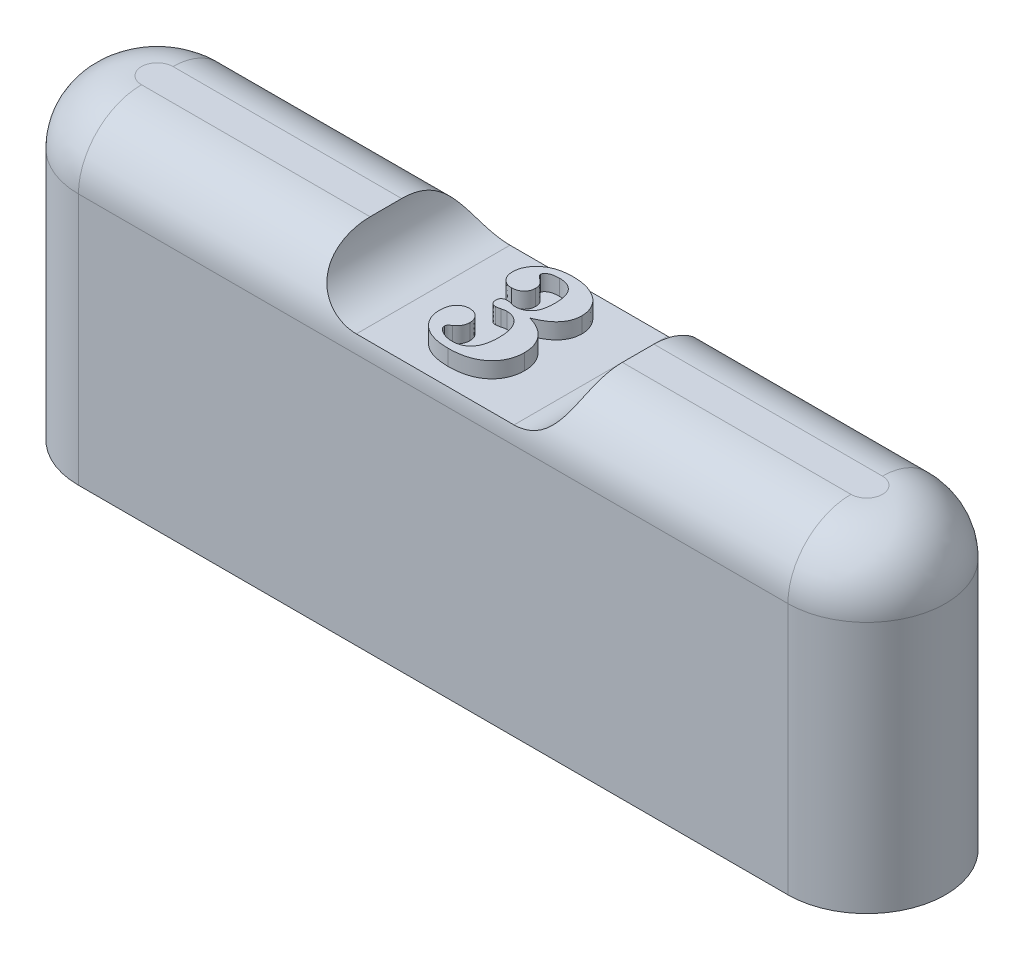
from build123d import *

# Parameters (mm, degrees)
BOSS_EXTRUDE1_DEPTH     = 20
FILLET1_R               = 4
SKETCH2_R               = 2.75
CUT_EXTRUDE1_DEPTH      = 1.5
LPATTERN1_COUNT         = 2
LPATTERN1_PITCH         = 30
CUT_EXTRUDE2_DEPTH      = 35.369317712
CUT_EXTRUDE2_DEPTH_BACK = 35.369317712
WRAP1_DEPTH             = 1


# Read off the part's stored shape, not the designer's step: Wrap1
with BuildPart() as part:
    # Sketch1 → Boss-Extrude1 (new body)
    with BuildSketch(Plane(origin=(0, 0, 0), x_dir=(1, 0, 0), z_dir=(0, 1, 0))):
        with BuildLine():
            Line((22.5, -5), (-22.5, -5))
            ThreePointArc((-22.5, -5), (-27.5, 0), (-22.5, 5))
            Line((-22.5, 5), (22.5, 5))
            ThreePointArc((22.5, 5), (27.5, 0), (22.5, -5))
        make_face()
    extrude(amount=BOSS_EXTRUDE1_DEPTH)

    # Fillet1
    fillet1_edges = [part.edges().sort_by_distance(p)[0] for p in [
        (-27.5, 20, 0),
        (0, 20, 5),
        (27.5, 20, 0),
        (0, 20, -5),
    ]]
    fillet(fillet1_edges, radius=FILLET1_R)

    # Sketch2 → Cut-Extrude1 (cut)
    with BuildSketch(Plane.XZ):
        with Locations(Location((-22.5, 0, 0), (0, 0, 270))):
            Circle(SKETCH2_R)
    cut_extrude1 = extrude(amount=-CUT_EXTRUDE1_DEPTH, mode=Mode.SUBTRACT)

    # LPattern1: Cut-Extrude1 ×2
    with Locations(*[(i * LPATTERN1_PITCH, 0, 0) for i in range(1, LPATTERN1_COUNT)]):
        add(cut_extrude1, mode=Mode.SUBTRACT)

    # Sketch3 → Cut-Extrude2 (cut, two sides: drawn at the far end of the back side and taken through both)
    with BuildSketch(Plane.XY.offset(-CUT_EXTRUDE2_DEPTH_BACK)):
        with BuildLine():
            Line((-5, 23), (5, 23))
            ThreePointArc((5, 23), (8, 20), (5, 17))
            Line((5, 17), (-5, 17))
            ThreePointArc((-5, 17), (-8, 20), (-5, 23))
        make_face()
    extrude(amount=CUT_EXTRUDE2_DEPTH + CUT_EXTRUDE2_DEPTH_BACK, mode=Mode.SUBTRACT)

    # Wrap1 outline → Wrap1 (add)
    with BuildSketch(Plane(origin=(0, 17, 0), x_dir=(1, 0, 0), z_dir=(0, 1, 0))):
        with BuildLine():
            add(Edge.make_bspline(
                [(2.361186809, -1.562724739), (2.358936063, -1.642416183), (2.354521526, -1.798720277), (2.32263398, -2.027872613), (2.266249939, -2.244790925), (2.188119546, -2.450129201), (2.091831204, -2.645528484), (1.966868403, -2.825594366), (1.824652142, -2.996727537), (1.65918003, -3.153264834), (1.474410823, -3.294496531), (1.27162083, -3.418493187), (1.050690637, -3.522780333), (0.812275633, -3.607617071), (0.556367941, -3.673236459), (0.28287175, -3.718531246), (-0.007811165, -3.748432548), (-0.207645189, -3.751734077), (-0.31028755, -3.753429868)],
                knots=[0, 0, 0, 0, 0.061354375, 0.120338389, 0.177702509, 0.233546768, 0.289283374, 0.3449562, 0.401886605, 0.460365064, 0.51992708, 0.580664812, 0.643036542, 0.707697668, 0.775236972, 0.846171603, 0.920987881, 1, 1, 1, 1], degree=3))
            add(Edge.make_bspline(
                [(0.624007322, 0.502980389), (0.694363155, 0.482741857), (0.831874438, 0.443185413), (1.02740048, 0.366120544), (1.210793188, 0.283964567), (1.380029067, 0.190457087), (1.535517537, 0.087559953), (1.679820629, -0.023012478), (1.809194549, -0.144808387), (1.925167532, -0.275441854), (2.027972458, -0.413012739), (2.116353701, -0.558215329), (2.191887622, -0.709393145), (2.255222154, -0.867186368), (2.302888581, -1.032105612), (2.336290336, -1.203752461), (2.358006646, -1.381075408), (2.360119546, -1.501763193), (2.361186809, -1.562724739)],
                knots=[0, 0, 0, 0, 0.075025699, 0.146638589, 0.215271416, 0.280976256, 0.344630791, 0.406315274, 0.467154943, 0.526516949, 0.585236113, 0.643010064, 0.700575913, 0.758349864, 0.817112444, 0.876302356, 0.937518121, 1, 1, 1, 1], degree=3))
            add(Edge.make_bspline(
                [(2.156058604, 2.272211158), (2.151771848, 2.181525798), (2.143309797, 2.002513021), (2.074708117, 1.741373033), (1.962761703, 1.495703312), (1.83395055, 1.304553765), (1.70700455, 1.162189231), (1.597891224, 1.054509002), (1.470220171, 0.955468322), (1.330325856, 0.856344283), (1.174738268, 0.763142335), (1.005278854, 0.670570327), (0.82048556, 0.583282024), (0.690502902, 0.530157464), (0.624007322, 0.502980389)],
                knots=[0, 0, 0, 0, 0.108587554, 0.214351684, 0.321241858, 0.430999345, 0.489069076, 0.549749196, 0.614451706, 0.682490285, 0.755190336, 0.831693801, 0.913899143, 1, 1, 1, 1], degree=3))
            add(Edge.make_bspline(
                [(-0.279838832, 4.14400603), (-0.157357142, 4.140985963), (0.079990149, 4.135133623), (0.422790871, 4.088566309), (0.739891528, 4.010904136), (1.028548789, 3.899630755), (1.289047424, 3.764529224), (1.517589649, 3.604544138), (1.71433849, 3.423204268), (1.873120708, 3.217672668), (1.998783534, 2.997948183), (2.089517596, 2.76593386), (2.146708195, 2.522840543), (2.152917989, 2.356392537), (2.156058604, 2.272211158)],
                knots=[0, 0, 0, 0, 0.10695053, 0.207250721, 0.301516556, 0.391461648, 0.476821793, 0.557207781, 0.634455968, 0.709589712, 0.783146573, 0.854802433, 0.926566069, 1, 1, 1, 1], degree=3))
            add(Edge.make_bspline(
                [(-2.000992678, 3.538236799), (-1.950449089, 3.587285963), (-1.849201756, 3.685539712), (-1.672695867, 3.806855819), (-1.481361956, 3.911138376), (-1.273937972, 3.99840966), (-1.049047665, 4.063820316), (-0.807482815, 4.109244053), (-0.549271825, 4.138986214), (-0.371271112, 4.142302552), (-0.279838832, 4.14400603)],
                knots=[0, 0, 0, 0, 0.112520394, 0.225397328, 0.341295234, 0.46082693, 0.584695833, 0.715280351, 0.853750211, 1, 1, 1, 1], degree=3))
            add(Edge.make_bspline(
                [(-2.459326011, 2.496570132), (-2.458422807, 2.544223667), (-2.456626238, 2.639011565), (-2.432043319, 2.778796807), (-2.39838683, 2.91596632), (-2.345251724, 3.04770288), (-2.281405572, 3.176962423), (-2.201929684, 3.302140116), (-2.10942833, 3.424633497), (-2.037566369, 3.499920139), (-2.000992678, 3.538236799)],
                knots=[0, 0, 0, 0, 0.122161592, 0.242992273, 0.363386459, 0.4840848, 0.606730262, 0.733038715, 0.864131742, 1, 1, 1, 1], degree=3))
            add(Edge.make_bspline(
                [(-1.613172165, 1.579903466), (-1.670691333, 1.582817891), (-1.783577705, 1.588537704), (-1.944660288, 1.638574348), (-2.091701292, 1.71925779), (-2.220564617, 1.831251337), (-2.326080958, 1.969543422), (-2.405265192, 2.127843577), (-2.450176571, 2.306655204), (-2.456200042, 2.431684395), (-2.459326011, 2.496570132)],
                knots=[0, 0, 0, 0, 0.123503177, 0.242385729, 0.359144057, 0.482175805, 0.606759678, 0.731136659, 0.860469416, 1, 1, 1, 1], degree=3))
            add(Edge.make_bspline(
                [(-0.81830037, 2.315480389), (-0.821026256, 2.264447662), (-0.8263186, 2.16536691), (-0.869167775, 2.022915244), (-0.943734194, 1.896045689), (-1.042845988, 1.784541099), (-1.162705506, 1.692435373), (-1.300832872, 1.628353149), (-1.452030242, 1.586024445), (-1.558385148, 1.581984552), (-1.613172165, 1.579903466)],
                knots=[0, 0, 0, 0, 0.126444231, 0.245493237, 0.364814777, 0.488720188, 0.613543272, 0.736823611, 0.86442892, 1, 1, 1, 1], degree=3))
            add(Edge.make_bspline(
                [(-1.24778755, 3.001377825), (-1.207150225, 2.970005913), (-1.131787845, 2.911826346), (-1.035010933, 2.820984441), (-0.958206948, 2.738654777), (-0.902818224, 2.659121006), (-0.864401787, 2.579872645), (-0.836830656, 2.497613288), (-0.82052087, 2.408540067), (-0.819054037, 2.347066044), (-0.81830037, 2.315480389)],
                knots=[0, 0, 0, 0, 0.182070801, 0.337652372, 0.470523462, 0.580943793, 0.680135151, 0.782042625, 0.888012428, 1, 1, 1, 1], degree=3))
            add(Edge.make_bspline(
                [(-1.433684986, 3.249775261), (-1.432930177, 3.229260144), (-1.431547568, 3.191681915), (-1.411917574, 3.146236861), (-1.38299006, 3.115082097), (-1.349546998, 3.083846064), (-1.303891536, 3.04437996), (-1.267721727, 3.016656814), (-1.24778755, 3.001377825)],
                knots=[0, 0, 0, 0, 0.188481556, 0.345248003, 0.443161045, 0.579238055, 0.768106505, 1, 1, 1, 1], degree=3))
            add(Edge.make_bspline(
                [(-0.611569601, 3.631185517), (-0.67466762, 3.629680056), (-0.793299335, 3.626849613), (-0.959707154, 3.605420198), (-1.102279818, 3.567634544), (-1.220510347, 3.515651031), (-1.311214143, 3.452639514), (-1.38070205, 3.390332034), (-1.425211158, 3.321847626), (-1.430989057, 3.272704918), (-1.433684986, 3.249775261)],
                knots=[0, 0, 0, 0, 0.19340588, 0.363625855, 0.512994624, 0.644183797, 0.757282422, 0.849945944, 0.929985784, 1, 1, 1, 1], degree=3))
            add(Edge.make_bspline(
                [(0.617597066, 2.129582953), (0.616949129, 2.193199043), (0.61569456, 2.316375908), (0.5982878, 2.494399593), (0.575872674, 2.659668873), (0.540998999, 2.81117428), (0.493951733, 2.947466028), (0.440068676, 3.071397779), (0.373735305, 3.180813238), (0.298283543, 3.278113084), (0.212295989, 3.361701662), (0.118864292, 3.434448987), (0.017148299, 3.495697856), (-0.09258844, 3.545481145), (-0.210766936, 3.584440495), (-0.337225266, 3.610279926), (-0.471559074, 3.629643619), (-0.563950288, 3.630661098), (-0.611569601, 3.631185517)],
                knots=[0, 0, 0, 0, 0.085873572, 0.166272986, 0.241360724, 0.311004539, 0.375793903, 0.435856468, 0.493138333, 0.548120936, 0.601684393, 0.654642041, 0.707717483, 0.761629576, 0.81706464, 0.875359625, 0.935759162, 1, 1, 1, 1], degree=3))
            add(Edge.make_bspline(
                [(0.325930399, 0.999775261), (0.34979199, 1.029606611), (0.398939993, 1.091050601), (0.457601614, 1.198594471), (0.506736798, 1.319851301), (0.548999291, 1.454144316), (0.577681208, 1.603812394), (0.602922905, 1.766118197), (0.614454213, 1.943523643), (0.616523143, 2.0660059), (0.617597066, 2.129582953)],
                knots=[0, 0, 0, 0, 0.096159815, 0.198061519, 0.307357594, 0.425781566, 0.552299199, 0.691147288, 0.839683351, 1, 1, 1, 1], degree=3))
            add(Edge.make_bspline(
                [(-0.496184986, 0.656826543), (-0.45339357, 0.657560135), (-0.370158604, 0.658987071), (-0.2488401, 0.675570645), (-0.134762014, 0.702222868), (-0.028162986, 0.741400097), (0.07165143, 0.78973363), (0.165913917, 0.847077893), (0.250902559, 0.918086105), (0.300869664, 0.972489518), (0.325930399, 0.999775261)],
                knots=[0, 0, 0, 0, 0.139400172, 0.271151778, 0.398277016, 0.520563852, 0.640497354, 0.759364307, 0.879310449, 1, 1, 1, 1], degree=3))
            add(Edge.make_bspline(
                [(-0.799069601, 0.716121414), (-0.74290008, 0.698710621), (-0.643958036, 0.668041684), (-0.54078609, 0.660211515), (-0.496184986, 0.656826543)],
                knots=[0, 0, 0, 0, 0.567701235, 1, 1, 1, 1], degree=3))
            add(Edge.make_bspline(
                [(-1.031441396, 0.759390645), (-0.998170363, 0.756510277), (-0.91937348, 0.749688606), (-0.843123783, 0.728413414), (-0.799069601, 0.716121414)],
                knots=[0, 0, 0, 0, 0.422237936, 1, 1, 1, 1], degree=3))
            add(Edge.make_bspline(
                [(-1.433684986, 0.390800902), (-1.432632454, 0.419777271), (-1.430637024, 0.474711744), (-1.411167167, 0.550863966), (-1.380589691, 0.616032529), (-1.335880562, 0.66916981), (-1.277435033, 0.70941308), (-1.207323243, 0.74130247), (-1.122747752, 0.755037912), (-1.062975826, 0.757887344), (-1.031441396, 0.759390645)],
                knots=[0, 0, 0, 0, 0.138834815, 0.263208175, 0.374439269, 0.481790582, 0.592071981, 0.712606806, 0.848377303, 1, 1, 1, 1], degree=3))
            add(Edge.make_bspline(
                [(-1.09554396, 0.041441927), (-1.120167503, 0.042924514), (-1.167815, 0.045793375), (-1.236097453, 0.060613182), (-1.295138713, 0.090869702), (-1.346248356, 0.130733566), (-1.384148233, 0.183758716), (-1.414593735, 0.243849807), (-1.429549719, 0.314802404), (-1.432258039, 0.364576274), (-1.433684986, 0.390800902)],
                knots=[0, 0, 0, 0, 0.134273141, 0.259823658, 0.376868709, 0.492678997, 0.608999304, 0.728652424, 0.857033635, 1, 1, 1, 1], degree=3))
            add(Edge.make_bspline(
                [(-0.795864473, 0.08951885), (-0.826774571, 0.082200342), (-0.884616008, 0.068505365), (-0.966098787, 0.054928109), (-1.034892712, 0.043812045), (-1.0768155, 0.042173794), (-1.09554396, 0.041441927)],
                knots=[0, 0, 0, 0, 0.31333056, 0.586329099, 0.81519791, 1, 1, 1, 1], degree=3))
            add(Edge.make_bspline(
                [(-0.468941396, 0.14400603), (-0.491400066, 0.14327422), (-0.539696256, 0.141700501), (-0.616919054, 0.131652591), (-0.703383984, 0.113422645), (-0.76387603, 0.097787029), (-0.795864473, 0.08951885)],
                knots=[0, 0, 0, 0, 0.202759475, 0.436023603, 0.701766965, 1, 1, 1, 1], degree=3))
            add(Edge.make_bspline(
                [(0.720161168, -1.54349397), (0.719404532, -1.474022007), (0.717941429, -1.339684497), (0.702011776, -1.144745506), (0.674221066, -0.964675051), (0.640649779, -0.797241441), (0.591386039, -0.645025178), (0.535396712, -0.504893751), (0.465062362, -0.380444515), (0.387140569, -0.269295424), (0.299127832, -0.172911953), (0.207251416, -0.087360826), (0.107819741, -0.016933646), (0.005001465, 0.044457826), (-0.106282596, 0.088341279), (-0.222271629, 0.120652927), (-0.343795428, 0.140536302), (-0.426665383, 0.142833908), (-0.468941396, 0.14400603)],
                knots=[0, 0, 0, 0, 0.089659443, 0.173373917, 0.252164698, 0.32478559, 0.393476985, 0.458396676, 0.519206122, 0.577557919, 0.633215921, 0.687389211, 0.739248931, 0.790220988, 0.841564769, 0.893088794, 0.94545937, 1, 1, 1, 1], degree=3))
            add(Edge.make_bspline(
                [(-0.56028755, -3.240609355), (-0.512144759, -3.239418078), (-0.417598984, -3.237078575), (-0.280103403, -3.217610481), (-0.149774682, -3.185775904), (-0.028559483, -3.139099522), (0.085345531, -3.080574517), (0.192213171, -3.010163209), (0.289268128, -2.924191216), (0.380684806, -2.827845817), (0.460552094, -2.715877963), (0.532130832, -2.590873918), (0.58779116, -2.449665027), (0.639629476, -2.296934383), (0.674180199, -2.128277877), (0.702192456, -1.945997766), (0.717865499, -1.749429975), (0.719380802, -1.613497791), (0.720161168, -1.54349397)],
                knots=[0, 0, 0, 0, 0.059792206, 0.117423613, 0.172153936, 0.226142792, 0.27838593, 0.331032237, 0.384664997, 0.439137156, 0.495692256, 0.555129784, 0.617620129, 0.683943919, 0.755285008, 0.831127377, 0.913032156, 1, 1, 1, 1], degree=3))
            add(Edge.make_bspline(
                [(-1.388813191, -3.005032432), (-1.326762526, -3.041271764), (-1.202709422, -3.113722263), (-0.998064924, -3.185811636), (-0.783096611, -3.233238212), (-0.635337139, -3.238126506), (-0.56028755, -3.240609355)],
                knots=[0, 0, 0, 0, 0.24650055, 0.492809516, 0.742389192, 1, 1, 1, 1], degree=3))
            add(Edge.make_bspline(
                [(-1.638813191, -2.650865765), (-1.635525923, -2.682956802), (-1.628774393, -2.748866733), (-1.576590694, -2.842307841), (-1.49554347, -2.929517608), (-1.426238698, -2.97855278), (-1.388813191, -3.005032432)],
                knots=[0, 0, 0, 0, 0.212636247, 0.436721323, 0.695821952, 1, 1, 1, 1], degree=3))
            add(Edge.make_bspline(
                [(-1.40804396, -2.35599397), (-1.432530306, -2.373700037), (-1.47648022, -2.405480202), (-1.536538016, -2.447089971), (-1.575554546, -2.48651643), (-1.612403194, -2.524172223), (-1.635665453, -2.58020497), (-1.637709266, -2.626084743), (-1.638813191, -2.650865765)],
                knots=[0, 0, 0, 0, 0.230116423, 0.41303007, 0.553895719, 0.651787808, 0.811920297, 1, 1, 1, 1], degree=3))
            add(Edge.make_bspline(
                [(-1.023428575, -1.647660637), (-1.024756951, -1.684047215), (-1.027351706, -1.755122173), (-1.044803636, -1.858774269), (-1.076126362, -1.955872301), (-1.117726268, -2.048400365), (-1.172707083, -2.134791447), (-1.238918118, -2.216017483), (-1.318403421, -2.289883149), (-1.377676921, -2.333597966), (-1.40804396, -2.35599397)],
                knots=[0, 0, 0, 0, 0.129765424, 0.253474568, 0.373369941, 0.492719229, 0.614282922, 0.737462889, 0.865496811, 1, 1, 1, 1], degree=3))
            add(Edge.make_bspline(
                [(-1.802274729, -0.881634996), (-1.747563784, -0.884540299), (-1.641398317, -0.89017798), (-1.489466836, -0.929946958), (-1.354607111, -1.001355674), (-1.238131371, -1.097847722), (-1.141465794, -1.213679014), (-1.073674652, -1.347024311), (-1.029160356, -1.492590265), (-1.025376183, -1.594969124), (-1.023428575, -1.647660637)],
                knots=[0, 0, 0, 0, 0.134279191, 0.260566015, 0.381986206, 0.505901784, 0.629817363, 0.749468442, 0.87105847, 1, 1, 1, 1], degree=3))
            add(Edge.make_bspline(
                [(-2.664454216, -1.91849397), (-2.662322419, -1.841810451), (-2.658252449, -1.695408361), (-2.610235024, -1.489135668), (-2.535995461, -1.307242718), (-2.428789443, -1.154854744), (-2.298236967, -1.033768689), (-2.14918775, -0.944186924), (-1.980945194, -0.891276625), (-1.86301429, -0.884912697), (-1.802274729, -0.881634996)],
                knots=[0, 0, 0, 0, 0.151527419, 0.28929203, 0.416768361, 0.538233618, 0.654975674, 0.766880183, 0.879933125, 1, 1, 1, 1], degree=3))
            add(Edge.make_bspline(
                [(-0.31028755, -3.753429868), (-0.401161612, -3.752010628), (-0.577902106, -3.749250355), (-0.835392871, -3.724436258), (-1.077474417, -3.686088756), (-1.303160892, -3.627086301), (-1.513875989, -3.555893533), (-1.709433109, -3.46791105), (-1.887567505, -3.361339409), (-2.049983843, -3.241347548), (-2.194152689, -3.108280262), (-2.320256294, -2.965116236), (-2.426410414, -2.812221453), (-2.51359043, -2.651015013), (-2.582040612, -2.480728418), (-2.629325318, -2.300902926), (-2.659190085, -2.112330976), (-2.662681261, -1.983778123), (-2.664454216, -1.91849397)],
                knots=[0, 0, 0, 0, 0.081203508, 0.157932285, 0.231010373, 0.300029536, 0.366164379, 0.429625425, 0.491284509, 0.551349815, 0.609805188, 0.666309249, 0.721540184, 0.775802975, 0.82979833, 0.885159131, 0.941679328, 1, 1, 1, 1], degree=3))
        make_face()
    extrude(amount=WRAP1_DEPTH)


solid = part.part
